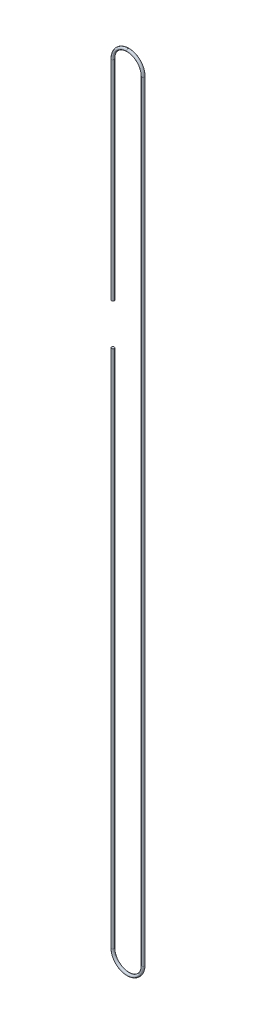
from build123d import *

# Parameters (mm, degrees)
SKETCH2_R               = 1.5875
CUT_EXTRUDE1_DEPTH      = 909.251190664
CUT_EXTRUDE1_DEPTH_BACK = 909.251190664
SKETCH3_W               = 36.037797304
SKETCH3_H               = 47.625


with BuildPart() as part:
    # Sweep1: sweep along a path in Sketch1
    with BuildLine(Plane.XY) as sweep1_path:
        Line((-17.4625, 889), (-17.4625, 0))
        ThreePointArc((-17.4625, 0), (0, -17.4625), (17.4625, 0))
        Line((17.4625, 0), (17.4625, 889))
        ThreePointArc((17.4625, 889), (0, 906.4625), (-17.4625, 889))
    # Sketch2 → Sweep1 (sweep)
    with BuildSketch(Plane(origin=(0, 0, 0), x_dir=(0, 0, -1), z_dir=(1, 0, 0))):
        with Locations((0, 906.4625)):
            Circle(SKETCH2_R)
    sweep(path=sweep1_path.line)

    # Sketch3 → Cut-Extrude1 (cut, two sides: drawn at the far end of the back side and taken through both)
    with BuildSketch(Plane.XY.offset(-CUT_EXTRUDE1_DEPTH_BACK)):
        with Locations((-20.239587833, 623.8875)):
            Rectangle(SKETCH3_W, SKETCH3_H)
    extrude(amount=CUT_EXTRUDE1_DEPTH + CUT_EXTRUDE1_DEPTH_BACK, mode=Mode.SUBTRACT)


solid = part.part
